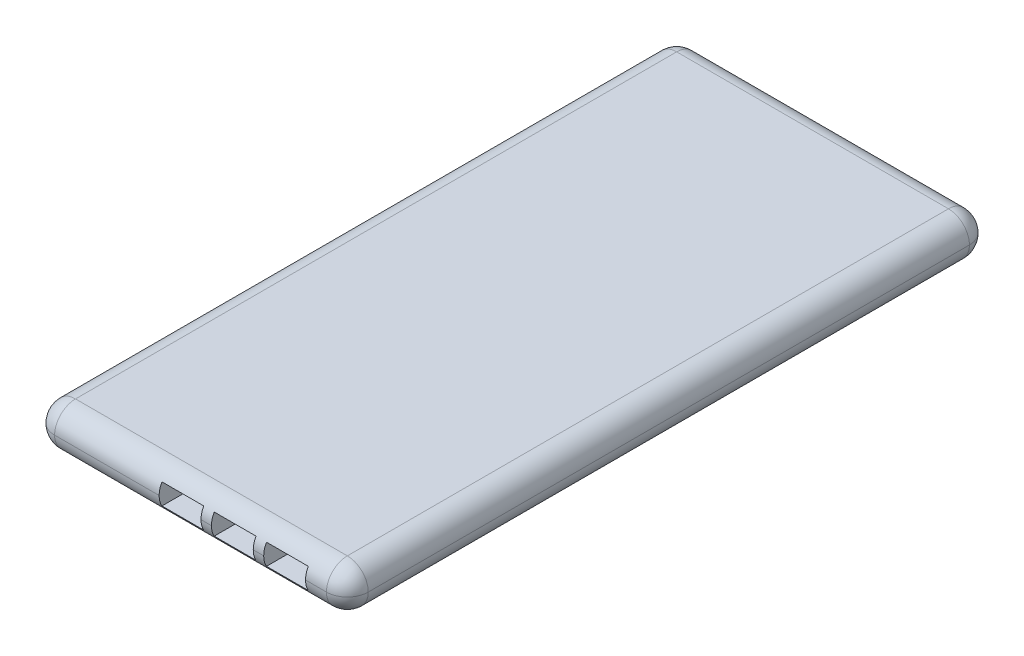
from build123d import *

# Parameters (mm, degrees)
SKETCH1_W           = 95.25
SKETCH1_H           = 195.2625
BOSS_EXTRUDE1_DEPTH = 12.7
FILLET1_R           = 6.35
SKETCH2_W           = 12.7
SKETCH2_H           = 6.35
CUT_EXTRUDE1_DEPTH  = 12.7


with BuildPart() as part:
    # Sketch1 → Boss-Extrude1 (new body)
    with BuildSketch(Plane(origin=(0, 0, 0), x_dir=(1, 0, 0), z_dir=(0, 1, 0))):
        with Locations((47.625, 97.63125)):
            Rectangle(SKETCH1_W, SKETCH1_H)
    extrude(amount=BOSS_EXTRUDE1_DEPTH)

    # Fillet1
    fillet1_edges = [part.edges().sort_by_distance(p)[0] for p in [
        (95.25, 12.7, -97.63125),
        (47.625, 12.7, -195.2625),
        (0, 12.7, -97.63125),
        (47.625, 0, -195.2625),
        (95.25, 0, -97.63125),
        (47.625, 0, 0),
        (0, 0, -97.63125),
        (0, 6.35, -195.2625),
        (95.25, 6.35, -195.2625),
        (95.25, 6.35, 0),
        (0, 6.35, 0),
        (47.625, 12.7, 0),
    ]]
    fillet(fillet1_edges, radius=FILLET1_R - 0.0001)  # a hair under: the kernel refuses the full size

    # Sketch2 → Cut-Extrude1 (cut)
    with BuildSketch(Plane.XY):
        with Locations((76.2, 6.35)):
            Rectangle(SKETCH2_W, SKETCH2_H)
        with Locations((60.325, 6.35)):
            Rectangle(SKETCH2_W, SKETCH2_H)
        with Locations((44.45, 6.35)):
            Rectangle(SKETCH2_W, SKETCH2_H)
    extrude(amount=-CUT_EXTRUDE1_DEPTH, mode=Mode.SUBTRACT)


solid = part.part
